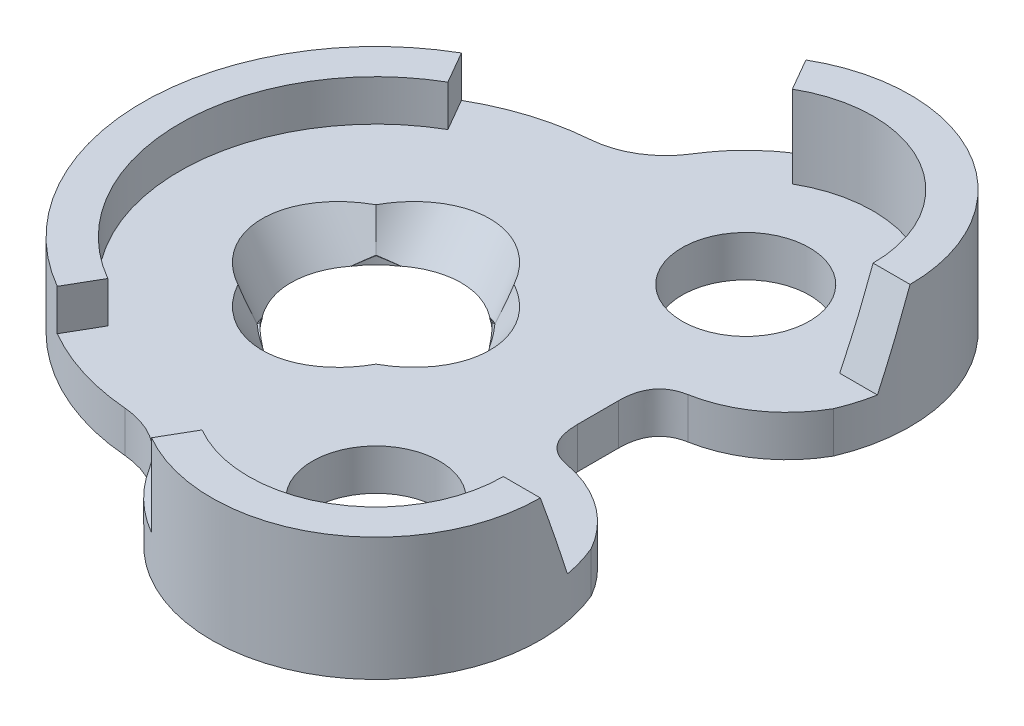
from build123d import *

# Parameters (mm, degrees)
SKETCH1_R                = 1.55
BOSS_EXTRUDE1_DEPTH      = 3
CUT_EXTRUDE1_DEPTH       = 2
SKETCH3_W                = 5.9
SKETCH3_H                = 3
BOSS_EXTRUDE2_DEPTH      = 8
SKETCH4_W                = 13.659458738
SKETCH4_H                = 9
CUT_EXTRUDE2_DEPTH       = 2
CUT_EXTRUDE2_DRAFT       = -20
SKETCH5_R                = 0.75
CUT_EXTRUDE3_DEPTH       = 1.3
CUT_EXTRUDE4_DEPTH       = 2
CUT_EXTRUDE5_DEPTH       = 2
CUT_EXTRUDE6_DEPTH       = 2
CUT_EXTRUDE7_DEPTH       = 18.586771109
CUT_EXTRUDE7_DEPTH_BACK  = 18.586771109
SKETCH11_R               = 2
SKETCH12_R               = 2.025
CUT_EXTRUDE8_DEPTH       = 6
CIRPATTERN1_COUNT        = 4
SKETCH13_W               = 4.09775222
SKETCH13_H               = 2.995
CUT_EXTRUDE9_DEPTH       = 10
CUT_EXTRUDE10_START      = -0.177953
SKETCH14_W               = 5.9
SKETCH14_H               = 1
CUT_EXTRUDE10_DEPTH      = 0.177953
FILLET1_SIZE             = 1
SKETCH17_R               = 1.662744167
BOSS_EXTRUDE4_DEPTH      = 1
SKETCH16_R               = 1.665674875
BOSS_EXTRUDE3_DEPTH      = 1
CUT_EXTRUDE11_DEPTH      = 18.453079278
CUT_EXTRUDE11_DEPTH_BACK = 18.453079278
SKETCH18_W               = 2.600219514
SKETCH18_H               = 5.959262744
CUT_EXTRUDE12_DEPTH      = 18.309245399
BOSS_EXTRUDE5_START      = -3
BOSS_EXTRUDE5_DEPTH      = 3
CUT_EXTRUDE13_DEPTH      = 3
SKETCH22_W               = 6.55065816
SKETCH22_H               = 15.562546266
CUT_EXTRUDE14_DEPTH      = 1
SKETCH23_W               = 5.9
SKETCH23_H               = 1
CUT_EXTRUDE15_DEPTH      = 6.491471
FILLET2_R                = 3


with BuildPart() as part:
    # Sketch1 → Boss-Extrude1 (new body)
    with BuildSketch(Plane(origin=(0, 0, 0), x_dir=(1, 0, 0), z_dir=(0, 1, 0))):
        with BuildLine():
            ThreePointArc((-3.635881537, 10.313312638), (-8.934039083, 9.995244626), (-9.252107096, 4.69708708))
            ThreePointArc((-9.252107096, 4.69708708), (-8.462514606, 2.666817501), (-9.252107096, 0.636547923))
            ThreePointArc((-9.252107096, 0.636547923), (-8.934039083, -4.661609623), (-3.635881537, -4.979677635))
            ThreePointArc((-3.635881537, -4.979677635), (-1.736579677, -4.192940503), (0.224018718, -4.811290568))
            ThreePointArc((0.224018718, -4.811290568), (5.628690512, -4.752701294), (6.040883178, 0.636547923))
            ThreePointArc((6.040883178, 0.636547923), (5.251290689, 2.666817501), (6.040883178, 4.69708708))
            ThreePointArc((6.040883178, 4.69708708), (5.722815166, 9.995244626), (0.42465762, 10.313312638))
            ThreePointArc((0.42465762, 10.313312638), (-1.605611959, 9.523720149), (-3.635881537, 10.313312638))
        make_face()
        with Locations(Location((-6.105611959, 7.166817501, 0), (0, 0, 270))):
            Circle(SKETCH1_R, mode=Mode.SUBTRACT)
        with Locations(Location((2.894388041, 7.166817501, 0), (0, 0, 270))):
            Circle(SKETCH1_R, mode=Mode.SUBTRACT)
        with Locations(Location((-6.105611959, -1.833182499, 0), (0, 0, 270))):
            Circle(SKETCH1_R, mode=Mode.SUBTRACT)
        with Locations(Location((2.894388041, -1.833182499, 0), (0, 0, 270))):
            Circle(SKETCH1_R, mode=Mode.SUBTRACT)
    extrude(amount=BOSS_EXTRUDE1_DEPTH)

    # Sketch2 → Cut-Extrude1 (cut)
    with BuildSketch(Plane(origin=(0, 3, 0), x_dir=(1, 0, 0), z_dir=(0, 1, 0))):
        with BuildLine():
            ThreePointArc((-3.492463443, 8.83458692), (-8.29764298, 9.358848523), (-7.773381378, 4.553668986))
            ThreePointArc((-7.773381378, 4.553668986), (-6.33006143, 2.666817501), (-7.773381378, 0.779966017))
            ThreePointArc((-7.773381378, 0.779966017), (-8.29764298, -4.02521352), (-3.492463443, -3.500951917))
            ThreePointArc((-3.492463443, -3.500951917), (-1.605611959, -2.05763197), (0.281239525, -3.500951917))
            ThreePointArc((0.281239525, -3.500951917), (5.086419063, -4.02521352), (4.56215746, 0.779966017))
            ThreePointArc((4.56215746, 0.779966017), (3.118837513, 2.666817501), (4.56215746, 4.553668986))
            ThreePointArc((4.56215746, 4.553668986), (5.086419063, 9.358848523), (0.281239525, 8.83458692))
            ThreePointArc((0.281239525, 8.83458692), (-1.605611959, 7.391266973), (-3.492463443, 8.83458692))
        make_face()
    extrude(amount=-CUT_EXTRUDE1_DEPTH, mode=Mode.SUBTRACT)

    # Sketch3 → Boss-Extrude2 (add)
    with BuildSketch(Plane(origin=(5.251290689, 0, -2.666817501), x_dir=(0, 0, -1), z_dir=(1, 0, 0))):
        with Locations((0, 1.5)):
            Rectangle(SKETCH3_W, SKETCH3_H)
    extrude(amount=BOSS_EXTRUDE2_DEPTH)


with BuildPart() as cut_extrude2_tool:
    # Sketch4 → Cut-Extrude2 (with draft: the straight prism first)
    with BuildSketch(Plane(origin=(0, 3, 0), x_dir=(1, 0, 0), z_dir=(0, 1, 0))):
        with Locations((7.288008407, 2.666817501)):
            Rectangle(SKETCH4_W, SKETCH4_H)
    extrude(amount=-CUT_EXTRUDE2_DEPTH)
    # Cut-Extrude2: the draft: its side faces are tilted about the plane it starts from
    cut_extrude2_sides = [cut_extrude2_tool.faces().sort_by_distance(p)[0] for p in [
        (7.288008407, 2, 1.833182499),
        (14.117737776, 2, -2.666817501),
        (7.288008407, 2, -7.166817501),
        (0.458279038, 2, -2.666817501),
    ]]
    draft(cut_extrude2_sides, Plane(origin=(0, 3, 0), x_dir=(1, 0, 0), z_dir=(0, 1, 0)), CUT_EXTRUDE2_DRAFT)


with BuildPart() as part_1:
    add(part.part)

    # Cut-Extrude2: cut by cut_extrude2_tool
    add(cut_extrude2_tool.part, mode=Mode.SUBTRACT)

    # Sketch5 → Cut-Extrude3 (cut)
    with BuildSketch(Plane(origin=(0, 1, 0), x_dir=(1, 0, 0), z_dir=(0, 1, 0))):
        with Locations(Location((10.394388041, 2.716817501, 0), (0, 0, 270))):
            Circle(SKETCH5_R)
    extrude(amount=-CUT_EXTRUDE3_DEPTH, mode=Mode.SUBTRACT)

    # Sketch6 → Cut-Extrude4 (cut)
    with BuildSketch(Plane(origin=(0, 3, 0), x_dir=(1, 0, 0), z_dir=(0, 1, 0))):
        with BuildLine():
            Line((-3.492463443, -3.500951917), (-3.702450132, -1.327552789))
            Line((-3.702450132, -1.327552789), (0.368176256, -0.93426223))
            Line((0.368176256, -0.93426223), (0.281239525, -3.500951917))
            ThreePointArc((0.281239525, -3.500951917), (-1.605611959, -2.432230608), (-3.492463443, -3.500951917))
        make_face()
    extrude(amount=-CUT_EXTRUDE4_DEPTH, mode=Mode.SUBTRACT)

    # Sketch9 → Cut-Extrude5 (cut)
    with BuildSketch(Plane(origin=(0, 3, 0), x_dir=(1, 0, 0), z_dir=(0, 1, 0))):
        with BuildLine():
            Line((-7.773381378, 4.553668986), (-3.245284386, 5.2751304))
            Line((-3.245284386, 5.2751304), (-4.565802385, 0.235004819))
            Line((-4.565802385, 0.235004819), (-7.773381378, 0.779966017))
            ThreePointArc((-7.773381378, 0.779966017), (-6.704660068, 2.666817501), (-7.773381378, 4.553668986))
        make_face()
    extrude(amount=-CUT_EXTRUDE5_DEPTH, mode=Mode.SUBTRACT)

    # Sketch10 → Cut-Extrude6 (cut)
    with BuildSketch(Plane(origin=(0, 3, 0), x_dir=(1, 0, 0), z_dir=(0, 1, 0))):
        with BuildLine():
            Line((-3.492463443, 8.83458692), (-4.484720145, 5.022165409))
            Line((-4.484720145, 5.022165409), (-0.857976827, 4.078235061))
            Line((-0.857976827, 4.078235061), (0.281239525, 8.83458692))
            ThreePointArc((0.281239525, 8.83458692), (-1.605611959, 7.765865611), (-3.492463443, 8.83458692))
        make_face()
    extrude(amount=-CUT_EXTRUDE6_DEPTH, mode=Mode.SUBTRACT)

    # Sketch11 → Cut-Extrude7 (cut, two sides: drawn at the far end of the back side and taken through both)
    with BuildSketch(Plane.XZ.offset(-CUT_EXTRUDE7_DEPTH_BACK)):
        with Locations(Location((-1.605611959, -2.666817501, 0), (0, 0, 90))):
            Circle(SKETCH11_R)
    extrude(amount=CUT_EXTRUDE7_DEPTH + CUT_EXTRUDE7_DEPTH_BACK, mode=Mode.SUBTRACT)

    # Sketch12 → Cut-Extrude8 (cut)
    with BuildSketch(Plane(origin=(3.468967433, 4.954198925, 0), x_dir=(0.8191520442889871, -0.5735764363510527, -5.842048773291199e-15), z_dir=(0.5735764363510527, 0.8191520442889871, 8.343310310865899e-15))):
        with Locations((-1.643071141, 2.666817501)):
            Circle(SKETCH12_R)
    cut_extrude8 = extrude(amount=-CUT_EXTRUDE8_DEPTH, mode=Mode.SUBTRACT)

    # CirPattern1: Cut-Extrude8 ×4 about axis
    cirpattern1_axis = Axis((-1.605611959, 0, -2.666817501), (0, 1, 0))
    for i in range(1, CIRPATTERN1_COUNT):
        add(cut_extrude8.rotate(cirpattern1_axis, i * 360 / CIRPATTERN1_COUNT), mode=Mode.SUBTRACT)

    # Sketch13 → Cut-Extrude9 (cut)
    with BuildSketch(Plane(origin=(0, 1, 0), x_dir=(1, 0, 0), z_dir=(0, 1, 0))):
        with Locations((5.845511931, 2.666817501)):
            Rectangle(SKETCH13_W, SKETCH13_H)
    extrude(amount=-CUT_EXTRUDE9_DEPTH, mode=Mode.SUBTRACT)

    # Sketch14 → Cut-Extrude10 (cut)
    with BuildSketch(Plane(origin=(13.251290689, 0, 0), x_dir=(0, 0, -1), z_dir=(1, 0, 0)).offset(CUT_EXTRUDE10_START)):
        with Locations((2.666817501, 0.5)):
            Rectangle(SKETCH14_W, SKETCH14_H)
    extrude(amount=CUT_EXTRUDE10_DEPTH, mode=Mode.SUBTRACT)

    # Fillet1
    # a fillet whose section is not a circle: 1 mm, written as the material it adds along each edge
    with BuildSketch(Plane(origin=(7.894388041, 1, -4.164317501), x_dir=(-1, 0, 0), z_dir=(0, -1, 0)), Plane(origin=(3.796635821, 1, -4.164317501), x_dir=(0, 0, 1), z_dir=(0, -1, 0))) as fillet1_piece_1:
        with BuildLine():
            Bezier((FILLET1_SIZE, 0), (0, 0), (0, -FILLET1_SIZE), weights=[1, 1, 1])
            Line((0, -FILLET1_SIZE), (0, 0))
            Line((0, 0), (FILLET1_SIZE, 0))
        make_face()
    extrude(amount=1)
    with BuildSketch(Plane(origin=(7.894388041, 1, -1.169317501), x_dir=(-1, 0, 0), z_dir=(0, -1, 0)), Plane(origin=(3.796635821, 1, -1.169317501), x_dir=(0, 0, -1), z_dir=(0, -1, 0))) as fillet1_piece_2:
        with BuildLine():
            Bezier((FILLET1_SIZE, 0), (0, 0), (0, FILLET1_SIZE), weights=[1, 1, 1])
            Line((0, FILLET1_SIZE), (0, 0))
            Line((0, 0), (FILLET1_SIZE, 0))
        make_face()
    extrude(amount=1)

    # Sketch17 → Boss-Extrude4 (add)
    with BuildSketch(Plane(origin=(0, 1, 0), x_dir=(1, 0, 0), z_dir=(0, 1, 0))):
        with Locations((-6.105611959, -1.833182499)):
            Circle(SKETCH17_R)
    extrude(amount=-BOSS_EXTRUDE4_DEPTH)

    # Sketch16 → Boss-Extrude3 (add)
    with BuildSketch(Plane(origin=(0, 1, 0), x_dir=(1, 0, 0), z_dir=(0, 1, 0))):
        with Locations((-6.105611959, 7.166817501)):
            Circle(SKETCH16_R)
    extrude(amount=-BOSS_EXTRUDE3_DEPTH)

    # Sketch15 → Cut-Extrude11 (cut, two sides: drawn at the far end of the back side and taken through both)
    with BuildSketch(Plane.XZ.offset(-CUT_EXTRUDE11_DEPTH_BACK)):
        with BuildLine():
            Line((6.894388041, -7.166817501), (6.894388041, -13.928074113))
            Line((6.894388041, -13.928074113), (-13.514201906, -13.928074113))
            Line((-13.514201906, -13.928074113), (-13.514201906, 8.046636231))
            Line((-13.514201906, 8.046636231), (6.894388041, 8.046636231))
            Line((6.894388041, 8.046636231), (6.894388041, 1.833182499))
            ThreePointArc((6.894388041, 1.833182499), (3.988180525, 5.68072951), (-0.50742096, 3.9373915))
            ThreePointArc((-0.50742096, 3.9373915), (-1.166872385, 3.282048931), (-2.051368819, 2.995664359))
            ThreePointArc((-2.051368819, 2.995664359), (-7.285611959, -2.666817501), (-2.051368819, -8.329299362))
            ThreePointArc((-2.051368819, -8.329299362), (-1.166872385, -8.615683934), (-0.50742096, -9.271026503))
            ThreePointArc((-0.50742096, -9.271026503), (3.988180525, -11.014364512), (6.894388041, -7.166817501))
        make_face()
    extrude(amount=CUT_EXTRUDE11_DEPTH + CUT_EXTRUDE11_DEPTH_BACK, mode=Mode.SUBTRACT)

    # Sketch18 → Cut-Extrude12 (cut, through all)
    with BuildSketch(Plane(origin=(0, 1, 0), x_dir=(1, 0, 0), z_dir=(0, 1, 0))):
        with Locations((-7.701659958, 2.979631372)):
            Rectangle(SKETCH18_W, SKETCH18_H)
    extrude(amount=CUT_EXTRUDE12_DEPTH, mode=Mode.SUBTRACT)

    # Sketch19 → Boss-Extrude5 (add)
    with BuildSketch(Plane.XZ.offset(BOSS_EXTRUDE5_START)):
        with BuildLine():
            Line((-3.995611959, -6.806418932), (-4.445611959, -7.585841795))
            ThreePointArc((-4.445611959, -7.585841795), (-7.285611959, -2.666817501), (-4.445611959, 2.252206792))
            Line((-4.445611959, 2.252206792), (-3.995611959, 1.472783929))
            ThreePointArc((-3.995611959, 1.472783929), (-6.385611959, -2.666817501), (-3.995611959, -6.806418932))
        make_face()
    extrude(amount=BOSS_EXTRUDE5_DEPTH)

    # Sketch20 → Cut-Extrude13 (cut)
    with BuildSketch(Plane(origin=(0, 1, 0), x_dir=(1, 0, 0), z_dir=(0, 1, 0))):
        Polygon((2.894388041, 7.166817501), (-0.075580701, 12.31095426), (-3.796704653, 11.559770235), (-3.289503394, -7.421479647), (-0.182006076, -7.161653415), (2.894388041, -1.833182499), align=None)
    extrude(amount=CUT_EXTRUDE13_DEPTH, mode=Mode.SUBTRACT)

    # Sketch22 → Cut-Extrude14 (cut)
    with BuildSketch(Plane(origin=(0, 3, 0), x_dir=(1, 0, 0), z_dir=(0, 1, 0))):
        with Locations((-5.379656345, 2.553222273)):
            Rectangle(SKETCH22_W, SKETCH22_H)
    extrude(amount=-CUT_EXTRUDE14_DEPTH, mode=Mode.SUBTRACT)

    # Sketch23 → Cut-Extrude15 (cut)
    with BuildSketch(Plane(origin=(13.073337513, 0, 0), x_dir=(0, 0, -1), z_dir=(1, 0, 0))):
        with Locations((2.666817501, 0.5)):
            Rectangle(SKETCH23_W, SKETCH23_H)
    extrude(amount=-CUT_EXTRUDE15_DEPTH, mode=Mode.SUBTRACT)

    # Fillet2
    # the kernel refuses this fillet: 3 mm, written as the material it takes off along each edge
    with BuildSketch(Plane(origin=(6.581866513, 6.178617069, -4.164317501), x_dir=(-0.999932634511536, 1.396498453398939e-14, 0.011607171869965063), z_dir=(0, -1, 0)), Plane(origin=(6.581866513, -5.178617069, -1.169317501), x_dir=(-0.999932634511536, 1.3964984533989391e-14, -0.01160717186996909), z_dir=(0, 1, 0))) as fillet2_piece_1:
        with BuildLine():
            CenterArc((2.578666289, 2.956810514), FILLET2_R, 210.097266111, 50.168799246)
            Line((-0.016859759, 1.452402148), (-0.276412364, 1.301961311))
            ThreePointArc((-0.276412364, 1.301961311), (-0.308409499, 0.722718924), (-0.29997979, -0.003482152))
            Line((-0.29997979, -0.003482152), (0.003482152, -0.29997979))
            ThreePointArc((0.003482152, -0.29997979), (1.788592581, -0.279258311), (2.020724882, -0.295681051))
            Line((2.020724882, -0.295681051), (2.071446828, 0))
        make_face()
    extrude(amount=11.357234139, mode=Mode.SUBTRACT)


solid = part_1.part
